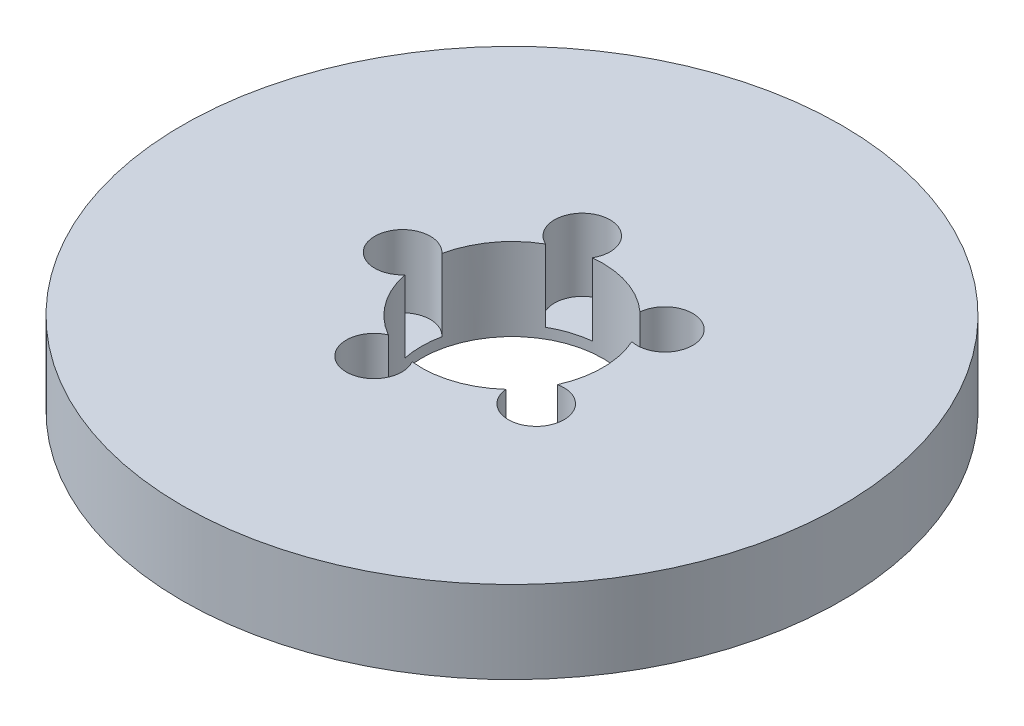
from build123d import *

# Parameters (mm, degrees)
SKETCH1_R           = 100
BOSS_EXTRUDE1_DEPTH = 25
SKETCH2_R           = 27.5
CUT_EXTRUDE1_DEPTH  = 144.614066163
SKETCH3_R           = 8.430379984
CUT_EXTRUDE2_DEPTH  = 21.875239797
CIRPATTERN1_COUNT   = 5


with BuildPart() as part:
    # Sketch1 → Boss-Extrude1 (new body)
    with BuildSketch(Plane(origin=(0, 0, 0), x_dir=(1, 0, 0), z_dir=(0, 1, 0))):
        Circle(SKETCH1_R)
    extrude(amount=BOSS_EXTRUDE1_DEPTH)

    # Sketch2 → Cut-Extrude1 (cut, through all)
    with BuildSketch(Plane(origin=(0, 0, 0), x_dir=(1, 0, 0), z_dir=(0, 1, 0))):
        Circle(SKETCH2_R)
    extrude(amount=CUT_EXTRUDE1_DEPTH, mode=Mode.SUBTRACT)

    # Sketch3 → Cut-Extrude2 (cut)
    with BuildSketch(Plane(origin=(0, 25, 0), x_dir=(1, 0, 0), z_dir=(0, 1, 0))):
        with Locations((-33.21057203, 0)):
            Circle(SKETCH3_R)
    cut_extrude2 = extrude(amount=-CUT_EXTRUDE2_DEPTH, mode=Mode.SUBTRACT)

    # CirPattern1: Cut-Extrude2 ×5 about axis
    cirpattern1_axis = Axis((0, 0, 0), (0, 1, 0))
    for i in range(1, CIRPATTERN1_COUNT):
        add(cut_extrude2.rotate(cirpattern1_axis, i * 360 / CIRPATTERN1_COUNT), mode=Mode.SUBTRACT)


solid = part.part
